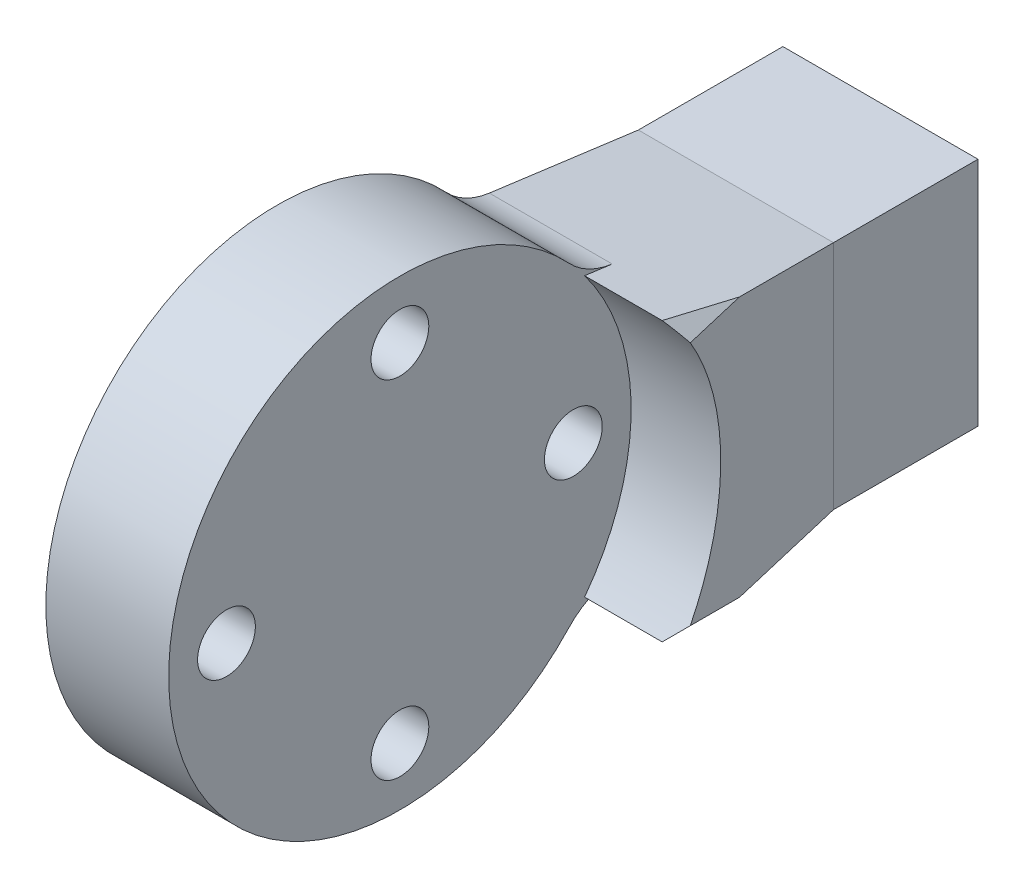
from build123d import *
from OCP.BRepFilletAPI import BRepFilletAPI_MakeChamfer

# Parameters (mm, degrees)
BOSS_EXTRUDE1_DEPTH = 16
CHAMFER1_SIZE       = 15
CHAMFER1_SIZE2      = 2
SKETCH2_R           = 3
CUT_EXTRUDE1_DEPTH  = 15
CHAMFER2_SIZE       = 2
THREAD1_PITCH       = 1.5
SKETCH5_R           = 7
BOSS_EXTRUDE2_DEPTH = 16
BOSS_EXTRUDE3_START = 10
SKETCH10_W          = 14
SKETCH10_H          = 16
SKETCH10_R          = 3
BOSS_EXTRUDE3_DEPTH = 10
BOSS_EXTRUDE4_START = 10
SKETCH11_R          = 3
BOSS_EXTRUDE4_DEPTH = 10
SKETCH12_R          = 16
CUT_EXTRUDE2_DEPTH  = 7
SKETCH13_R          = 16
BOSS_EXTRUDE5_DEPTH = 9
BOSS_EXTRUDE6_START = -9
BOSS_EXTRUDE6_DEPTH = 9
SKETCH15_R          = 2
CUT_EXTRUDE3_DEPTH  = 20
FILLET1_R           = 5
FILLET2_R           = 5
CUT_EXTRUDE4_START  = -0.5
CUT_EXTRUDE4_DEPTH  = 0.5
SKETCH17_R          = 4
CUT_EXTRUDE5_DEPTH  = 15


with BuildPart() as part:
    # Sketch1 → Boss-Extrude1 (new body)
    with BuildSketch(Plane(origin=(0, 0, 0), x_dir=(0, -1, 0), z_dir=(1, 0, 0))):
        with BuildLine():
            ThreePointArc((-10, 0), (0, 10), (10, 0))
            Line((10, 0), (10, 25))
            Line((10, 25), (-10, 25))
            Line((-10, 25), (-10, 0))
        make_face()
        with BuildLine():
            ThreePointArc((-4.5, 0), (0, 4.5), (4.5, 0))
            Line((4.5, 0), (10, 0))
            ThreePointArc((10, 0), (0, 10), (-10, 0))
            Line((-10, 0), (-4.5, 0))
        make_face()
        with BuildLine():
            Line((10, 0), (4.5, 0))
            ThreePointArc((4.5, 0), (0, -4.5), (-4.5, 0))
            Line((-4.5, 0), (-10, 0))
            ThreePointArc((-10, 0), (0, -10), (10, 0))
        make_face()
    extrude(amount=BOSS_EXTRUDE1_DEPTH)

    # Chamfer1: one chamfer whose edges measure the first distance from different faces: ONE call of the kernel's chamfer builder (chamfer() names one face for all edges)
    chamfer1_edges_1 = [part.edges().sort_by_distance(p)[0] for p in [
        (8, 10, -25),
    ]]
    chamfer1_side_1 = [part.faces().sort_by_distance(p)[0] for p in [
        (8, 10, -12.5),
    ]]
    chamfer1_edges_2 = [part.edges().sort_by_distance(p)[0] for p in [
        (8, -10, -25),
    ]]
    chamfer1_side_2 = [part.faces().sort_by_distance(p)[0] for p in [
        (8, -10, -12.5),
    ]]
    chamfer1_edges_3 = [part.edges().sort_by_distance(p)[0] for p in [
        (16, 0, -25),
    ]]
    chamfer1_side_3 = [part.faces().sort_by_distance(p)[0] for p in [
        (16, 0, -9.408066135),
    ]]
    chamfer1 = BRepFilletAPI_MakeChamfer(part.part.solid().wrapped)
    for e in chamfer1_edges_1:
        chamfer1.Add(CHAMFER1_SIZE, CHAMFER1_SIZE2, e.wrapped, chamfer1_side_1[0].wrapped)  # the first distance lies on this face
    for e in chamfer1_edges_2:
        chamfer1.Add(CHAMFER1_SIZE, CHAMFER1_SIZE2, e.wrapped, chamfer1_side_2[0].wrapped)  # the first distance lies on this face
    for e in chamfer1_edges_3:
        chamfer1.Add(CHAMFER1_SIZE, CHAMFER1_SIZE2, e.wrapped, chamfer1_side_3[0].wrapped)  # the first distance lies on this face
    add(Compound.cast(chamfer1.Shape()), mode=Mode.REPLACE)

    # Sketch2 → Cut-Extrude1 (cut)
    with BuildSketch(Plane(origin=(0, 0, -25), x_dir=(-1, 0, 0), z_dir=(0, 0, -1))):
        with Locations((-8, 0)):
            Circle(SKETCH2_R)
    extrude(amount=-CUT_EXTRUDE1_DEPTH, mode=Mode.SUBTRACT)

    # Chamfer2
    chamfer2_edges = [part.edges().sort_by_distance(p)[0] for p in [
        (0, 0, 10),
        (16, 0, 10),
        (16, 10, -5),
        (0, 10, -5),
        (0, -10, -5),
        (16, -10, -5),
    ]]
    chamfer(chamfer2_edges, length=CHAMFER2_SIZE)

    # Thread1: the profile of Thread Profile1 profile screwed along a right-hand helix of 11.333333 turns, 8 arcs to a turn; built about Z, then put on its axis
    thread1_z = Axis((0, 0, 0), (0, 0, 1))
    thread1_corners = [(4.4997, 0, -0.000173205), (5.311898812, 0, 0.468749998), (5.311898812, 0, 0.656249998), (4.4997, 0, 1.125173201)]
    with BuildLine(mode=Mode.PRIVATE) as thread1_profile:
        Line(thread1_corners[0], thread1_corners[1])
        Line(thread1_corners[1], thread1_corners[2])
        Line(thread1_corners[2], thread1_corners[3])
        Line(thread1_corners[3], thread1_corners[0])
    thread1_cap = Face(thread1_profile.wire())
    thread1_turn_angles = [0, 22.5, 45, 67.5, 90, 112.5, 135, 157.5, 180, 202.5, 225, 247.5, 270, 292.5, 315, 337.5, 360]
    thread1_turn_weights = [1, 0.9238795325112867, 1, 0.9238795325112867, 1, 0.9238795325112867, 1, 0.9238795325112867, 1, 0.9238795325112867, 1, 0.9238795325112867, 1, 0.9238795325112867, 1, 0.9238795325112867, 1]
    thread1_turn_rails = [Edge.make_bspline([Vector(p[0], p[1], 0).rotate(thread1_z, thread1_turn_angles[k]) / thread1_turn_weights[k] + Vector(0, 0, p[2] + THREAD1_PITCH * thread1_turn_angles[k] / 360) for k in range(17)], [0, 0, 0, 1, 1, 2, 2, 3, 3, 4, 4, 5, 5, 6, 6, 7, 7, 8, 8, 8], 2, thread1_turn_weights) for p in thread1_corners]
    thread1_turn_sides = [Face.make_surface_from_curves(thread1_turn_rails[p[0]], thread1_turn_rails[p[1]]) for p in [(0, 1), (1, 2), (2, 3), (3, 0)]]
    thread1_last_angles = [3960, 3982.5, 4005, 4027.5, 4050, 4065, 4080]
    thread1_last_weights = [1, 0.9238795325112867, 1, 0.9238795325112867, 1, 0.9659258262890693, 1]
    thread1_last_rails = [Edge.make_bspline([Vector(p[0], p[1], 0).rotate(thread1_z, thread1_last_angles[k]) / thread1_last_weights[k] + Vector(0, 0, p[2] + THREAD1_PITCH * thread1_last_angles[k] / 360) for k in range(7)], [0, 0, 0, 1, 1, 2, 2, 3, 3, 3], 2, thread1_last_weights) for p in thread1_corners]
    thread1_last_sides = [Face.make_surface_from_curves(thread1_last_rails[p[0]], thread1_last_rails[p[1]]) for p in [(0, 1), (1, 2), (2, 3), (3, 0)]]
    thread1 = Plane(origin=(-1, 0, 0), x_dir=(0, 0, -1), z_dir=(1, 0, 0)) * Solid(Shell([*[p.moved(Location((0, 0, THREAD1_PITCH * i))) for i in range(11) for p in thread1_turn_sides], *thread1_last_sides, thread1_cap, thread1_cap.rotate(thread1_z, 4080).moved(Location((0, 0, THREAD1_PITCH * 4080 / 360)))]))
    add(thread1, mode=Mode.SUBTRACT)

    # Sketch5 → Boss-Extrude2 (add)
    with BuildSketch(Plane.ZY):
        Circle(SKETCH5_R)
    extrude(amount=-BOSS_EXTRUDE2_DEPTH)

    # Sketch10 → Boss-Extrude3 (add)
    with BuildSketch(Plane(origin=(0, 0, -25), x_dir=(-1, 0, 0), z_dir=(0, 0, -1)).offset(BOSS_EXTRUDE3_START)):
        with Locations((-7, 0)):
            Rectangle(SKETCH10_W, SKETCH10_H)
        with Locations((-8, 0)):
            Circle(SKETCH10_R, mode=Mode.SUBTRACT)
    extrude(amount=-BOSS_EXTRUDE3_DEPTH)

    # Sketch11 → Boss-Extrude4 (add)
    with BuildSketch(Plane(origin=(0, 0, -10), x_dir=(-1, 0, 0), z_dir=(0, 0, -1)).offset(BOSS_EXTRUDE4_START)):
        with Locations((-8, 0)):
            Circle(SKETCH11_R)
    extrude(amount=-BOSS_EXTRUDE4_DEPTH)

    # Sketch12 → Cut-Extrude2 (cut)
    with BuildSketch(Plane(origin=(16, 0, 0), x_dir=(0, 0, -1), z_dir=(1, 0, 0))):
        Circle(SKETCH12_R)
    extrude(amount=-CUT_EXTRUDE2_DEPTH, mode=Mode.SUBTRACT)

    # Sketch13 → Boss-Extrude5 (add)
    with BuildSketch(Plane(origin=(9, 0, 0), x_dir=(0, 0, -1), z_dir=(1, 0, 0))):
        Circle(SKETCH13_R)
    extrude(amount=-BOSS_EXTRUDE5_DEPTH)

    # Sketch14 → Boss-Extrude6 (add)
    with BuildSketch(Plane.ZY.offset(BOSS_EXTRUDE6_START)):
        with BuildLine():
            Line((-25, -8), (-13.856406461, -8))
            ThreePointArc((-13.856406461, -8), (-13.341966778, -8.831303556), (-12.777718105, -9.629637586))
            Line((-12.777718105, -9.629637586), (-25, -8))
        make_face()
        with BuildLine():
            Line((-13.856406461, 8), (-25, 8))
            Line((-25, 8), (-12.777718105, 9.629637586))
            ThreePointArc((-12.777718105, 9.629637586), (-13.341966778, 8.831303556), (-13.856406461, 8))
        make_face()
    extrude(amount=BOSS_EXTRUDE6_DEPTH)

    # Sketch15 → Cut-Extrude3 (cut)
    with BuildSketch(Plane(origin=(9, 0, 0), x_dir=(0, 0, -1), z_dir=(1, 0, 0))):
        with Locations((12, 0)):
            Circle(SKETCH15_R)
        with Locations((0, 12)):
            Circle(SKETCH15_R)
        with Locations((-12, 0)):
            Circle(SKETCH15_R)
        with Locations((0, -12)):
            Circle(SKETCH15_R)
    extrude(amount=-CUT_EXTRUDE3_DEPTH, mode=Mode.SUBTRACT)

    # Fillet1
    fillet1_edges = [part.edges().sort_by_distance(p)[0] for p in [
        (4.5, -9.629637586, -12.777718105),
    ]]
    fillet(fillet1_edges, radius=FILLET1_R)

    # Fillet2
    fillet2_edges = [part.edges().sort_by_distance(p)[0] for p in [
        (4.5, 9.629637586, -12.777718105),
    ]]
    fillet(fillet2_edges, radius=FILLET2_R)

    # Sketch16 → Cut-Extrude4 (cut)
    with BuildSketch(Plane.ZY.offset(CUT_EXTRUDE4_START)):
        with BuildLine():
            Line((-14.689269432, 9.374764076), (-25, 8))
            Line((-25, 8), (-35, 8))
            Line((-35, 8), (-35, -8))
            Line((-35, -8), (-25, -8))
            Line((-25, -8), (-14.689269432, -9.374764076))
            ThreePointArc((-14.689269432, -9.374764076), (-13.058341289, -9.887042998), (-11.695305168, -10.918783679))
            ThreePointArc((-11.695305168, -10.918783679), (16, 0), (-11.695305168, 10.918783679))
            ThreePointArc((-11.695305168, 10.918783679), (-13.058341289, 9.887042998), (-14.689269432, 9.374764076))
        make_face()
    extrude(amount=CUT_EXTRUDE4_DEPTH, mode=Mode.SUBTRACT)

    # Sketch17 → Cut-Extrude5 (cut)
    with BuildSketch(Plane(origin=(0, 0, -35), x_dir=(-1, 0, 0), z_dir=(0, 0, -1))):
        with Locations((-8, 0)):
            Circle(SKETCH17_R)
    extrude(amount=-CUT_EXTRUDE5_DEPTH, mode=Mode.SUBTRACT)


solid = part.part
